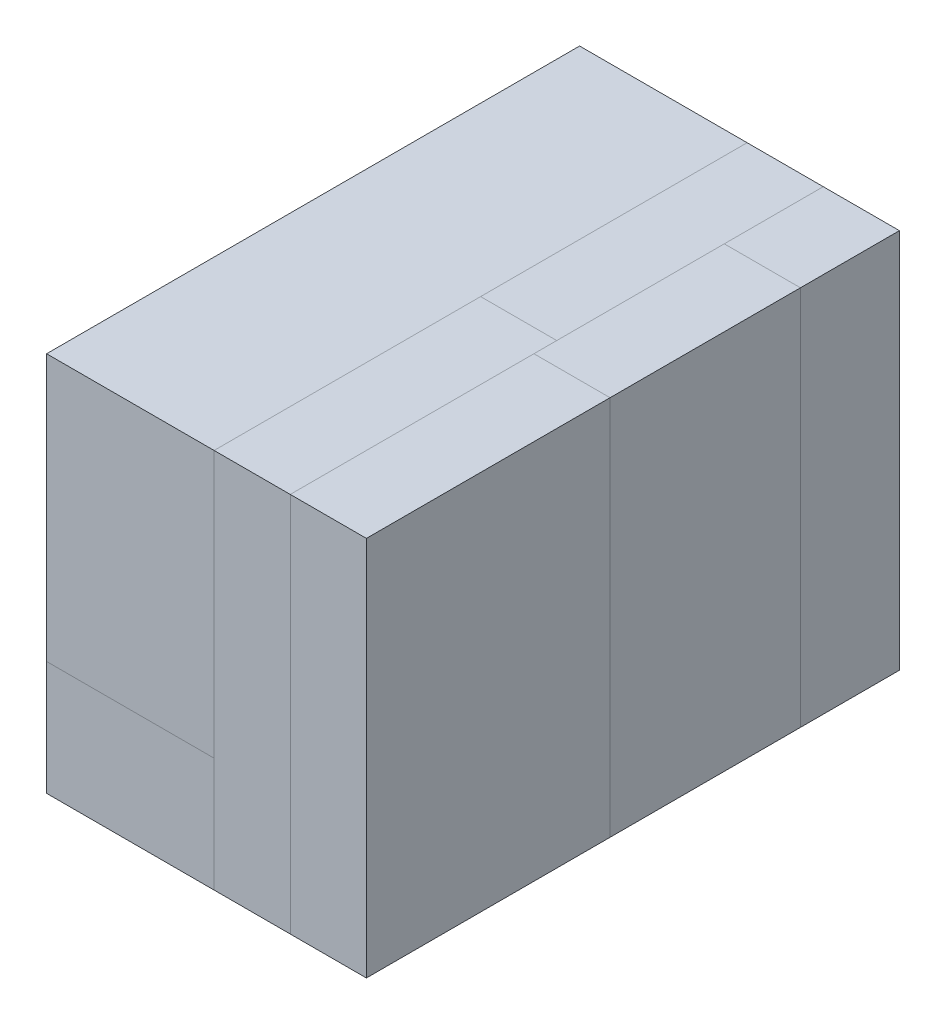
from build123d import *

# Parameters (mm, degrees)
SKETCH_1_W         = 220
SKETCH_1_H         = 700
EXTRUDE_484_DEPTH  = 150
SKETCH_3_W         = 220
SKETCH_3_H         = 700
EXTRUDE_18_DEPTH   = 350
SKETCH_5_W         = 350
SKETCH_5_H         = 500
EXTRUDE_1_DEPTH    = 100
SKETCH_8_W         = 350
SKETCH_8_H         = 500
EXTRUDE_2_DEPTH    = 100
SKETCH_6_W         = 320
SKETCH_6_H         = 500
EXTRUDE_19_DEPTH   = 100
SKETCH_9_W         = 250
SKETCH_9_H         = 500
LED_DEPTH          = 100
SKETCH_10_W        = 130
SKETCH_10_H        = 500
EXTRUDE_1382_DEPTH = 100


with BuildPart() as part:
    # 草图1 → Extrude 484 (new body)
    with BuildSketch(Plane(origin=(0, 0, 0), x_dir=(1, 0, 0), z_dir=(0, 1, 0))):
        with Locations((110, 350)):
            Rectangle(SKETCH_1_W, SKETCH_1_H)
    extrude(amount=EXTRUDE_484_DEPTH)


with BuildPart() as body_2:
    # 草图3 → 18寸墙体 (new body)
    with BuildSketch(Plane(origin=(0, 150, 0), x_dir=(1, 0, 0), z_dir=(0, 1, 0))):
        with Locations((110, 350)):
            Rectangle(SKETCH_3_W, SKETCH_3_H)
    extrude(amount=EXTRUDE_18_DEPTH)


with BuildPart() as body_3:
    # 草图5 → 液晶挂壁1 (new body)
    with BuildSketch(Plane(origin=(220, 0, 0), x_dir=(0, 0, -1), z_dir=(1, 0, 0))):
        with Locations((175, 250)):
            Rectangle(SKETCH_5_W, SKETCH_5_H)
    extrude(amount=EXTRUDE_1_DEPTH)


with BuildPart() as body_4:
    # 草图8 → 液晶挂壁2 (new body)
    with BuildSketch(Plane(origin=(220, 0, 0), x_dir=(0, 0, -1), z_dir=(1, 0, 0))):
        with Locations((525, 250)):
            Rectangle(SKETCH_8_W, SKETCH_8_H)
    extrude(amount=EXTRUDE_2_DEPTH)


with BuildPart() as body_5:
    # 草图6 → 19寸液晶显示器 (new body)
    with BuildSketch(Plane(origin=(320, 0, 0), x_dir=(0, 0, -1), z_dir=(1, 0, 0))):
        with Locations((160, 250)):
            Rectangle(SKETCH_6_W, SKETCH_6_H)
    extrude(amount=EXTRUDE_19_DEPTH)


with BuildPart() as body_6:
    # 草图9 → LED灯 (new body)
    with BuildSketch(Plane(origin=(320, 0, 0), x_dir=(0, 0, -1), z_dir=(1, 0, 0))):
        with Locations((445, 250)):
            Rectangle(SKETCH_9_W, SKETCH_9_H)
    extrude(amount=LED_DEPTH)


with BuildPart() as body_7:
    # 草图10 → Extrude 1382 (new body)
    with BuildSketch(Plane(origin=(320, 0, 0), x_dir=(0, 0, -1), z_dir=(1, 0, 0))):
        with Locations((635, 250)):
            Rectangle(SKETCH_10_W, SKETCH_10_H)
    extrude(amount=EXTRUDE_1382_DEPTH)


solid = Compound([part.part, body_2.part, body_3.part, body_4.part, body_5.part, body_6.part, body_7.part])
